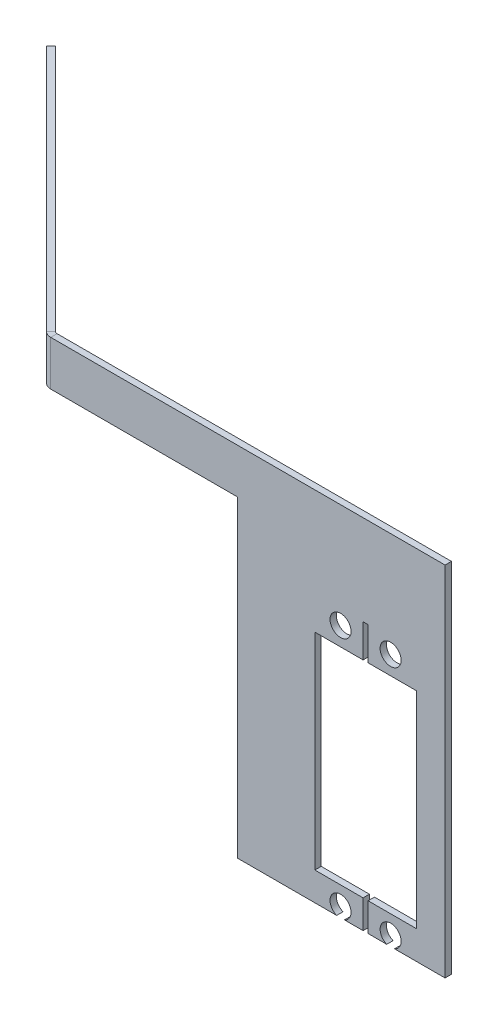
from build123d import *

# Parameters (mm, degrees)
BASE_FLANGE1_DEPTH      = 9.525
BASE_FLANGE1_DEPTH_BACK = 61.9125
SKETCH9_W               = 88.097631615
SKETCH9_H               = 62.483000002
CUT_EXTRUDE1_DEPTH      = 144.762808626
SKETCH12_R              = 2.099999991
CUT_EXTRUDE2_DEPTH      = 144.762808626


# Sheet-metal steps are written as plain solids
with BuildPart() as part:
    # Sketch2 → Base-Flange1 (new, two sides: drawn at the far end of the back side and taken through both)
    with BuildSketch(Plane(origin=(0, 71.4375, 0), x_dir=(1, 0, 0), z_dir=(0, 1, 0)).offset(-BASE_FLANGE1_DEPTH_BACK)):
        with BuildLine():
            Line((-106.452002215, 49.610155888), (-57.057591472, 0.215745145))
            ThreePointArc((-57.057591472, 0.215745145), (-56.818621234, 0.056070336), (-56.536736617, 0))
            Line((-56.536736617, 0), (22.225, 0))
            Line((22.225, 0), (22.225, -1.27))
            Line((22.225, -1.27), (-56.536736617, -1.27))
            ThreePointArc((-56.536736617, -1.27), (-57.304629193, -1.11725667), (-57.955617084, -0.682280467))
            Line((-57.955617084, -0.682280467), (-107.350027828, 48.712130276))
            Line((-107.350027828, 48.712130276), (-106.452002215, 49.610155888))
        make_face()
    extrude(amount=BASE_FLANGE1_DEPTH + BASE_FLANGE1_DEPTH_BACK)

    # Sketch9 → Cut-Extrude1 (cut, through all)
    with BuildSketch(Plane.XY.offset(1.27)):
        with Locations((-63.301212021, 40.766500001)):
            Rectangle(SKETCH9_W, SKETCH9_H)
    extrude(amount=-CUT_EXTRUDE1_DEPTH, mode=Mode.SUBTRACT)

    # Sketch12 → Cut-Extrude2 (cut, through all)
    with BuildSketch(Plane.XY.offset(1.27)):
        with Locations((11.350000033, 11.477000033)):
            Circle(SKETCH12_R)
        with Locations((1.349999967, 11.477000033)):
            Circle(SKETCH12_R)
        with Locations((11.350000033, 60.077000115)):
            Circle(SKETCH12_R)
        with Locations((1.349999967, 60.077000115)):
            Circle(SKETCH12_R)
        Polygon((6.85, 8.59600008), (5.85, 8.59600008), (5.85, 15.20000008), (-3.776999939, 15.20000008), (-3.776999939, 56.354000068), (5.85, 56.354000068), (5.85, 62.958000068), (6.85, 62.958000068), (6.85, 56.354000068), (16.476999939, 56.354000068), (16.476999939, 15.20000008), (6.85, 15.20000008), align=None)
    extrude(amount=-CUT_EXTRUDE2_DEPTH, mode=Mode.SUBTRACT)


solid = part.part
